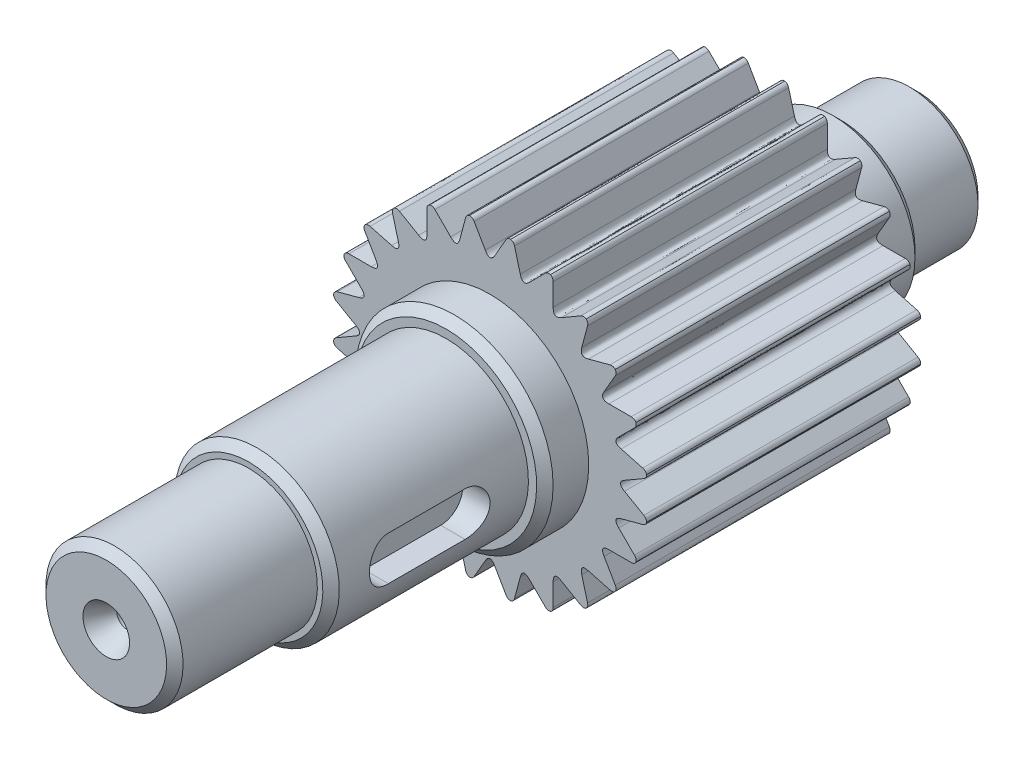
from build123d import *

# Parameters (mm, degrees)
CUT_EXTRUDE_1_DEPTH      = 127.723636311
PATTERN_START            = 28
PATTERN_CIRCULAR_1_DEPTH = 50
CUT_EXTRUDE_START        = 10
CUT_EXTRUDE_2_DEPTH      = 144.407591749
CHAMFER_1_SIZE           = 1.5


with BuildPart() as part:
    # Эскиз1 → Повернуть1 (revolve)
    with BuildSketch(Plane(origin=(0, 0, 0), x_dir=(0, 0, -1), z_dir=(1, 0, 0)), mode=Mode.PRIVATE) as revolve_1_sk:
        Polygon((0, 0), (-148, 0), (-148, -12.5), (-122, -12.5), (-122, -15), (-86, -15), (-86, -18), (-78, -18), (-78, -28.8), (-28, -28.8), (-28, -15), (-14, -15), (-14, -12.5), (0, -12.5), align=None)
    revolve(revolve_1_sk.sketch.rotate(Axis((0, 0, 0), (0, 0, 1)), 180), axis=Axis((0, 0, 0), (0, 0, 1)))

    # Эскиз2 → Вырез-Вытянуть1 (cut, through all)
    with BuildSketch(Plane(origin=(0, 0, 28), x_dir=(-1, 0, 0), z_dir=(0, 0, -1))):
        Polygon((5, 31.686751346), (-5, 31.686751346), (0, 23.026497308), align=None)
    extrude(amount=-CUT_EXTRUDE_1_DEPTH, mode=Mode.SUBTRACT)

    # Круговой массив1: read off the stored shape, not the designer's step
    # Круговой массив1 outline → Круговой массив1 (cut)
    with BuildSketch(Plane.XY.offset(PATTERN_START)):
        with BuildLine():
            Line((26.398581504, -11.513248654), (19.941531629, -11.513248654))
            Line((19.941531629, -11.513248654), (23.170056567, -17.105217879))
            ThreePointArc((23.170056567, -17.105217879), (24.941531629, -14.4), (26.398581504, -11.513248654))
        make_face()
        with BuildLine():
            Line((5.959696045, 22.241888439), (10.525519799, 26.807712191))
            ThreePointArc((10.525519799, 26.807712191), (7.453988499, 27.818663797), (4.288488562, 28.478919675))
            Line((4.288488562, 28.478919675), (5.959696045, 22.241888439))
        make_face()
        with BuildLine():
            Line((11.513248654, 19.941531629), (17.105217879, 23.170056567))
            ThreePointArc((17.105217879, 23.170056567), (14.4, 24.941531629), (11.513248654, 26.398581504))
            Line((11.513248654, 26.398581504), (11.513248654, 19.941531629))
        make_face()
        with BuildLine():
            Line((16.282192394, 16.282192394), (22.51922363, 17.953399876))
            ThreePointArc((22.51922363, 17.953399876), (20.364675298, 20.364675298), (17.953399876, 22.51922363))
            Line((17.953399876, 22.51922363), (16.282192394, 16.282192394))
        make_face()
        with BuildLine():
            Line((19.941531629, 11.513248654), (26.398581504, 11.513248654))
            ThreePointArc((26.398581504, 11.513248654), (24.941531629, 14.4), (23.170056567, 17.105217879))
            Line((23.170056567, 17.105217879), (19.941531629, 11.513248654))
        make_face()
        with BuildLine():
            Line((22.241888439, 5.959696045), (28.478919675, 4.288488562))
            ThreePointArc((28.478919675, 4.288488562), (27.818663797, 7.453988499), (26.807712192, 10.525519799))
            Line((26.807712192, 10.525519799), (22.241888439, 5.959696045))
        make_face()
        with BuildLine():
            Line((23.026497308, 0), (28.618466533, -3.228524938))
            ThreePointArc((28.618466533, -3.228524938), (28.8, 0), (28.618466533, 3.228524938))
            Line((28.618466533, 3.228524938), (23.026497308, 0))
        make_face()
        with BuildLine():
            Line((22.241888439, -5.959696045), (26.807712192, -10.525519799))
            ThreePointArc((26.807712192, -10.525519799), (27.818663797, -7.453988499), (28.478919675, -4.288488562))
            Line((28.478919675, -4.288488562), (22.241888439, -5.959696045))
        make_face()
        with BuildLine():
            ThreePointArc((-4.288488562, 28.478919675), (-7.453988499, 27.818663797), (-10.525519799, 26.807712191))
            Line((-10.525519799, 26.807712191), (-5.959696045, 22.241888439))
            Line((-5.959696045, 22.241888439), (-4.288488562, 28.478919675))
        make_face()
        with BuildLine():
            ThreePointArc((-11.513248654, 26.398581504), (-14.4, 24.941531629), (-17.105217879, 23.170056567))
            Line((-17.105217879, 23.170056567), (-11.513248654, 19.941531629))
            Line((-11.513248654, 19.941531629), (-11.513248654, 26.398581504))
        make_face()
        with BuildLine():
            ThreePointArc((-17.953399876, 22.51922363), (-20.364675298, 20.364675298), (-22.51922363, 17.953399876))
            Line((-22.51922363, 17.953399876), (-16.282192394, 16.282192394))
            Line((-16.282192394, 16.282192394), (-17.953399876, 22.51922363))
        make_face()
        with BuildLine():
            ThreePointArc((-23.170056567, 17.105217879), (-24.941531629, 14.4), (-26.398581504, 11.513248654))
            Line((-26.398581504, 11.513248654), (-19.941531629, 11.513248654))
            Line((-19.941531629, 11.513248654), (-23.170056567, 17.105217879))
        make_face()
        with BuildLine():
            ThreePointArc((-26.807712192, 10.525519799), (-27.818663797, 7.453988499), (-28.478919675, 4.288488562))
            Line((-28.478919675, 4.288488562), (-22.241888439, 5.959696045))
            Line((-22.241888439, 5.959696045), (-26.807712192, 10.525519799))
        make_face()
        with BuildLine():
            ThreePointArc((-28.618466533, 3.228524938), (-28.8, 0), (-28.618466533, -3.228524938))
            Line((-28.618466533, -3.228524938), (-23.026497308, 0))
            Line((-23.026497308, 0), (-28.618466533, 3.228524938))
        make_face()
        with BuildLine():
            ThreePointArc((-28.478919675, -4.288488562), (-27.818663797, -7.453988499), (-26.807712192, -10.525519799))
            Line((-26.807712192, -10.525519799), (-22.241888439, -5.959696045))
            Line((-22.241888439, -5.959696045), (-28.478919675, -4.288488562))
        make_face()
        with BuildLine():
            ThreePointArc((-26.398581504, -11.513248654), (-24.941531629, -14.4), (-23.170056567, -17.105217879))
            Line((-23.170056567, -17.105217879), (-19.941531629, -11.513248654))
            Line((-19.941531629, -11.513248654), (-26.398581504, -11.513248654))
        make_face()
        with BuildLine():
            ThreePointArc((-22.51922363, -17.953399876), (-20.364675298, -20.364675298), (-17.953399876, -22.51922363))
            Line((-17.953399876, -22.51922363), (-16.282192394, -16.282192394))
            Line((-16.282192394, -16.282192394), (-22.51922363, -17.953399876))
        make_face()
        with BuildLine():
            ThreePointArc((-17.105217879, -23.170056567), (-14.4, -24.941531629), (-11.513248654, -26.398581504))
            Line((-11.513248654, -26.398581504), (-11.513248654, -19.941531629))
            Line((-11.513248654, -19.941531629), (-17.105217879, -23.170056567))
        make_face()
        with BuildLine():
            ThreePointArc((-10.525519799, -26.807712192), (-7.453988499, -27.818663797), (-4.288488562, -28.478919675))
            Line((-4.288488562, -28.478919675), (-5.959696045, -22.241888439))
            Line((-5.959696045, -22.241888439), (-10.525519799, -26.807712192))
        make_face()
        with BuildLine():
            ThreePointArc((-3.228524938, -28.618466533), (0, -28.8), (3.228524938, -28.618466533))
            Line((3.228524938, -28.618466533), (0, -23.026497308))
            Line((0, -23.026497308), (-3.228524938, -28.618466533))
        make_face()
        with BuildLine():
            ThreePointArc((4.288488562, -28.478919675), (7.453988499, -27.818663797), (10.525519799, -26.807712192))
            Line((10.525519799, -26.807712192), (5.959696045, -22.241888439))
            Line((5.959696045, -22.241888439), (4.288488562, -28.478919675))
        make_face()
        with BuildLine():
            ThreePointArc((11.513248654, -26.398581504), (14.4, -24.941531629), (17.105217879, -23.170056567))
            Line((17.105217879, -23.170056567), (11.513248654, -19.941531629))
            Line((11.513248654, -19.941531629), (11.513248654, -26.398581504))
        make_face()
        with BuildLine():
            ThreePointArc((17.953399876, -22.51922363), (20.364675298, -20.364675298), (22.51922363, -17.953399876))
            Line((22.51922363, -17.953399876), (16.282192394, -16.282192394))
            Line((16.282192394, -16.282192394), (17.953399876, -22.51922363))
        make_face()
    extrude(amount=PATTERN_CIRCULAR_1_DEPTH, mode=Mode.SUBTRACT)

    # Эскиз4 → Вырез-Повернуть1 (revolve, cut)
    with BuildSketch(Plane(origin=(0, 0, 0), x_dir=(0, 0, -1), z_dir=(1, 0, 0)), mode=Mode.PRIVATE) as cut_revolve_1_sk:
        Polygon((-148, 0), (-137.945299462, 0), (-139.1, 2), (-144.1, 2), (-148, 4.25), align=None)
    cut_revolve_1 = revolve(cut_revolve_1_sk.sketch.rotate(Axis((0, 0, 148), (0, 0, -1)), 90), axis=Axis((0, 0, 148), (0, 0, -1)), mode=Mode.SUBTRACT)

    # Скругление5
    # a fillet whose section is not a circle: 1 mm, written as the material it adds along each edge
    with BuildSketch(Plane(origin=(5.959696045, 22.241888439, 28), x_dir=(0.7071067813414165, 0.7071067810316785, 0), z_dir=(0, 0, 1)), Plane(origin=(16.282192394, 16.282192394, 28), x_dir=(0.9659258263221286, 0.2588190449791379, 0), z_dir=(0, 0, 1)), Plane(origin=(22.241888439, 5.959696045, 28), x_dir=(0.9659258262834112, -0.25881904512363346, 0), z_dir=(0, 0, 1)), Plane(origin=(23.026497308, 0, 28), x_dir=(0.8660254037411079, -0.500000000075051, 0), z_dir=(0, 0, 1)), Plane(origin=(22.241888439, -5.959696045, 28), x_dir=(0.707106781109113, -0.7071067812639822, 0), z_dir=(0, 0, 1)), Plane(origin=(16.282192394, -16.282192394, 28), x_dir=(0.2588190449791379, -0.9659258263221286, 0), z_dir=(0, 0, 1)), Plane(origin=(5.959696045, -22.241888439, 28), x_dir=(-0.25881904512363346, -0.9659258262834112, 0), z_dir=(0, 0, 1)), Plane(origin=(0, -23.026497308, 28), x_dir=(-0.500000000075051, -0.8660254037411079, 0), z_dir=(0, 0, 1)), Plane(origin=(-5.959696045, -22.241888439, 28), x_dir=(-0.7071067812639822, -0.707106781109113, 0), z_dir=(0, 0, 1)), Plane(origin=(-16.282192394, -16.282192394, 28), x_dir=(-0.9659258263221286, -0.2588190449791379, 0), z_dir=(0, 0, 1)), Plane(origin=(-22.241888439, -5.959696045, 28), x_dir=(-0.9659258262834112, 0.25881904512363346, 0), z_dir=(0, 0, 1)), Plane(origin=(-23.026497308, 0, 28), x_dir=(-0.8660254037411079, 0.500000000075051, 0), z_dir=(0, 0, 1)), Plane(origin=(-22.241888439, 5.959696045, 28), x_dir=(-0.707106781109113, 0.7071067812639822, 0), z_dir=(0, 0, 1)), Plane(origin=(-16.282192394, 16.282192394, 28), x_dir=(-0.2588190449791379, 0.9659258263221286, 0), z_dir=(0, 0, 1)), Plane(origin=(-5.959696045, 22.241888439, 28), x_dir=(0.25881904512363313, 0.9659258262834113, 0), z_dir=(0, 0, 1))) as fillet_5_piece_1:
        with BuildLine():
            Bezier((1.732050807, 0), (0, 0), (0.866025403, 1.5), weights=[1, 1, 1])
            Line((0.866025403, 1.5), (0, 0))
            Line((0, 0), (1.732050807, 0))
        make_face()
    extrude(amount=50)
    with BuildSketch(Plane(origin=(11.513248654, 19.941531629, 28), x_dir=(0.8660254037411078, 0.5000000000750511, 0), z_dir=(0, 0, 1)), Plane(origin=(19.941531629, 11.513248654, 28), x_dir=(1, 0, 0), z_dir=(0, 0, 1)), Plane(origin=(19.941531629, -11.513248654, 28), x_dir=(0.5000000000750511, -0.8660254037411078, 0), z_dir=(0, 0, 1)), Plane(origin=(11.513248654, -19.941531629, 28), x_dir=(0, -1, 0), z_dir=(0, 0, 1)), Plane(origin=(-11.513248654, -19.941531629, 28), x_dir=(-0.8660254037411078, -0.5000000000750511, 0), z_dir=(0, 0, 1)), Plane(origin=(-19.941531629, -11.513248654, 28), x_dir=(-1, 0, 0), z_dir=(0, 0, 1)), Plane(origin=(-19.941531629, 11.513248654, 28), x_dir=(-0.5000000000750511, 0.8660254037411078, 0), z_dir=(0, 0, 1)), Plane(origin=(-11.513248654, 19.941531629, 28), x_dir=(0, 1, 0), z_dir=(0, 0, 1)), Plane(origin=(0, 23.026497308, 28), x_dir=(0.5000000000000009, 0.8660254037844382, 0), z_dir=(0, 0, 1))) as fillet_5_piece_2:
        with BuildLine():
            Bezier((1.732050808, 0), (0, 0), (0.866025404, 1.5), weights=[1, 1, 1])
            Line((0.866025404, 1.5), (0, 0))
            Line((0, 0), (1.732050808, 0))
        make_face()
    extrude(amount=50)
    # a fillet whose section is not a circle: 1 mm, written as the material it takes off along each edge
    with BuildSketch(Plane(origin=(-3.228524938, 28.618466533, 79.687470596), x_dir=(-0.9923148556587695, -0.12373854386938385, 0), z_dir=(0, 0, -1)), Plane(origin=(28.478919675, 4.288488562, 26.312529404), x_dir=(0.13730772809693784, -0.9905284386653709, 0), z_dir=(0, 0, 1)), Plane(origin=(4.288488562, -28.478919675, 26.312529404), x_dir=(-0.9905284386653699, -0.1373077280969445, 0), z_dir=(0, 0, 1)), Plane(origin=(-28.478919675, -4.288488562, 26.312529404), x_dir=(-0.13730772809693953, 0.9905284386653708, 0), z_dir=(0, 0, 1)), Plane(origin=(-4.288488562, 28.478919675, 26.312529404), x_dir=(0.9905284386653713, 0.13730772809693437, 0), z_dir=(0, 0, 1))) as fillet_5_2_piece_1:
        with BuildLine():
            Bezier((0.674988238, 0), (0.003323759, 0.007871471), (-0.257969453, -0.61093463), weights=[1, 1, 1])
            Line((-0.257969453, -0.61093463), (0, 0))
            ThreePointArc((0, 0), (0.337494119, 0.001977538), (0.674988238, 0))
        make_face()
    extrude(amount=53.374941192, mode=Mode.SUBTRACT)
    with BuildSketch(Plane(origin=(3.228524938, 28.618466533, 79.687470596), x_dir=(0.9923148556587701, -0.12373854386937931, 0), z_dir=(0, 0, -1))) as fillet_5_2_piece_2:
        with BuildLine():
            Bezier((0.674988238, 0), (0.003323759, -0.007871471), (-0.257969453, 0.61093463), weights=[1, 1, 1])
            Line((-0.257969453, 0.61093463), (0, 0))
            ThreePointArc((0, 0), (0.337494119, -0.001977538), (0.674988238, 0))
        make_face()
    extrude(amount=53.374941192, mode=Mode.SUBTRACT)
    with BuildSketch(Plane(origin=(4.288488562, 28.478919675, 26.312529404), x_dir=(0.2588190451236342, -0.965925826283411, 0), z_dir=(0, 0, 1)), Plane(origin=(11.513248654, 26.398581504, 26.312529404), x_dir=(0, -1, 0), z_dir=(0, 0, 1)), Plane(origin=(17.953399876, 22.51922363, 26.312529404), x_dir=(-0.2588190449791394, -0.9659258263221282, 0), z_dir=(0, 0, 1)), Plane(origin=(23.170056567, 17.105217879, 26.312529404), x_dir=(-0.5000000000750452, -0.8660254037411113, 0), z_dir=(0, 0, 1)), Plane(origin=(28.478919675, -4.288488562, 26.312529404), x_dir=(-0.9659258262834117, -0.2588190451236318, 0), z_dir=(0, 0, 1)), Plane(origin=(26.398581504, -11.513248654, 26.312529404), x_dir=(-1, 0, 0), z_dir=(0, 0, 1)), Plane(origin=(22.51922363, -17.953399876, 26.312529404), x_dir=(-0.9659258263221279, 0.2588190449791408, 0), z_dir=(0, 0, 1)), Plane(origin=(17.105217879, -23.170056567, 26.312529404), x_dir=(-0.8660254037411117, 0.5000000000750445, 0), z_dir=(0, 0, 1)), Plane(origin=(-4.288488562, -28.478919675, 26.312529404), x_dir=(-0.2588190451236318, 0.9659258262834117, 0), z_dir=(0, 0, 1)), Plane(origin=(-11.513248654, -26.398581504, 26.312529404), x_dir=(0, 1, 0), z_dir=(0, 0, 1)), Plane(origin=(-17.953399876, -22.51922363, 26.312529404), x_dir=(0.25881904497913705, 0.9659258263221288, 0), z_dir=(0, 0, 1)), Plane(origin=(-23.170056567, -17.105217879, 26.312529404), x_dir=(0.5000000000750469, 0.8660254037411104, 0), z_dir=(0, 0, 1)), Plane(origin=(-28.478919675, 4.288488562, 26.312529404), x_dir=(0.9659258262834117, 0.2588190451236318, 0), z_dir=(0, 0, 1)), Plane(origin=(-26.398581504, 11.513248654, 26.312529404), x_dir=(1, 0, 0), z_dir=(0, 0, 1)), Plane(origin=(-22.51922363, 17.953399876, 26.312529404), x_dir=(0.9659258263221279, -0.2588190449791407, 0), z_dir=(0, 0, 1)), Plane(origin=(-17.105217879, 23.170056567, 26.312529404), x_dir=(0.8660254037411104, -0.5000000000750469, 0), z_dir=(0, 0, 1))) as fillet_5_2_piece_3:
        with BuildLine():
            Bezier((0.663166164, 0), (-0.008544439, 0), (-0.262568201, -0.621825588), weights=[1, 1, 1])
            ThreePointArc((-0.262568201, -0.621825588), (-0.133105886, -0.310143538), (0, 0))
            Line((0, 0), (0.663166164, 0))
        make_face()
    extrude(amount=53.374941192, mode=Mode.SUBTRACT)
    with BuildSketch(Plane(origin=(10.525519799, 26.807712191, 26.312529403), x_dir=(0.9264766555512484, -0.3763522375628627, 0), z_dir=(0, 0, 1)), Plane(origin=(28.618466533, -3.228524938, 26.312529404), x_dir=(-0.12373854326896404, -0.9923148557336399, 0), z_dir=(0, 0, 1)), Plane(origin=(-3.228524938, -28.618466533, 26.312529404), x_dir=(-0.9923148557336408, 0.1237385432689579, 0), z_dir=(0, 0, 1)), Plane(origin=(-28.618466533, 3.228524938, 26.312529404), x_dir=(0.12373854326896444, 0.9923148557336399, 0), z_dir=(0, 0, 1))) as fillet_5_2_piece_4:
        with BuildLine():
            Bezier((0.674988239, 0), (0.003323759, 0.007871472), (-0.257969453, -0.610934629), weights=[1, 1, 1])
            Line((-0.257969453, -0.610934629), (0, 0))
            ThreePointArc((0, 0), (0.337494119, 0.001977538), (0.674988239, 0))
        make_face()
    extrude(amount=53.374941193, mode=Mode.SUBTRACT)
    with BuildSketch(Plane(origin=(17.105217879, 23.170056567, 26.312529404), x_dir=(0.7975006015373215, -0.6033181503548606, 0), z_dir=(0, 0, 1)), Plane(origin=(22.51922363, 17.953399876, 26.312529404), x_dir=(0.6141761999182358, -0.7891689270707477, 0), z_dir=(0, 0, 1)), Plane(origin=(23.170056567, -17.105217879, 26.312529404), x_dir=(-0.6033181503548574, -0.7975006015373242, 0), z_dir=(0, 0, 1)), Plane(origin=(17.953399876, -22.51922363, 26.312529404), x_dir=(-0.7891689270707438, -0.614176199918241, 0), z_dir=(0, 0, 1)), Plane(origin=(-17.105217879, -23.170056567, 26.312529404), x_dir=(-0.7975006015373254, 0.6033181503548556, 0), z_dir=(0, 0, 1)), Plane(origin=(-22.51922363, -17.953399876, 26.312529404), x_dir=(-0.6141761999182402, 0.7891689270707444, 0), z_dir=(0, 0, 1)), Plane(origin=(-23.170056567, 17.105217879, 26.312529404), x_dir=(0.6033181503548631, 0.7975006015373197, 0), z_dir=(0, 0, 1)), Plane(origin=(-17.953399876, 22.51922363, 26.312529404), x_dir=(0.7891689270707489, 0.6141761999182344, 0), z_dir=(0, 0, 1))) as fillet_5_2_piece_5:
        with BuildLine():
            Bezier((0.674988238, 0), (0.003323758, 0.007871471), (-0.257969453, -0.61093463), weights=[1, 1, 1])
            Line((-0.257969453, -0.61093463), (0, 0))
            ThreePointArc((0, 0), (0.337494119, 0.001977538), (0.674988238, 0))
        make_face()
    extrude(amount=53.374941192, mode=Mode.SUBTRACT)
    with BuildSketch(Plane(origin=(26.398581504, 11.513248654, 26.312529404), x_dir=(0.38899670559598415, -0.9212391454098502, 0), z_dir=(0, 0, 1)), Plane(origin=(11.513248654, -26.398581504, 26.312529404), x_dir=(-0.921239145409845, -0.38899670559599664, 0), z_dir=(0, 0, 1)), Plane(origin=(-26.398581504, -11.513248654, 26.312529404), x_dir=(-0.38899670559599564, 0.9212391454098453, 0), z_dir=(0, 0, 1)), Plane(origin=(-11.513248654, 26.398581504, 26.312529404), x_dir=(0.9212391454098502, 0.38899670559598415, 0), z_dir=(0, 0, 1))) as fillet_5_2_piece_6:
        with BuildLine():
            Bezier((0.674988238, 0), (0.003323759, 0.007871472), (-0.257969453, -0.61093463), weights=[1, 1, 1])
            Line((-0.257969453, -0.61093463), (0, 0))
            ThreePointArc((0, 0), (0.337494119, 0.001977538), (0.674988238, 0))
        make_face()
    extrude(amount=53.374941192, mode=Mode.SUBTRACT)
    with BuildSketch(Plane(origin=(26.807712192, 10.525519799, 26.312529404), x_dir=(-0.7071067811091118, -0.7071067812639832, 0), z_dir=(0, 0, 1)), Plane(origin=(10.525519799, -26.807712192, 26.312529404), x_dir=(-0.7071067812639845, 0.7071067811091105, 0), z_dir=(0, 0, 1)), Plane(origin=(-26.807712192, -10.525519799, 26.312529404), x_dir=(0.707106781109112, 0.7071067812639832, 0), z_dir=(0, 0, 1))) as fillet_5_2_piece_7:
        with BuildLine():
            Bezier((0.663166164, 0), (-0.008544439, 0), (-0.262568201, -0.621825588), weights=[1, 1, 1])
            ThreePointArc((-0.262568201, -0.621825588), (-0.133105886, -0.310143538), (0, 0))
            Line((0, 0), (0.663166164, 0))
        make_face()
    extrude(amount=53.374941191, mode=Mode.SUBTRACT)
    with BuildSketch(Plane(origin=(28.618466533, 3.228524938, 26.312529404), x_dir=(-0.866025403741108, -0.500000000075051, 0), z_dir=(0, 0, 1)), Plane(origin=(3.228524938, -28.618466533, 26.312529404), x_dir=(-0.5000000000750496, 0.8660254037411086, 0), z_dir=(0, 0, 1)), Plane(origin=(-28.618466533, -3.228524938, 26.312529404), x_dir=(0.8660254037411083, 0.5000000000750504, 0), z_dir=(0, 0, 1))) as fillet_5_2_piece_8:
        with BuildLine():
            Bezier((0.663166163, 0), (-0.008544439, 0), (-0.262568201, -0.621825588), weights=[1, 1, 1])
            ThreePointArc((-0.262568201, -0.621825588), (-0.133105886, -0.310143538), (0, 0))
            Line((0, 0), (0.663166163, 0))
        make_face()
    extrude(amount=53.374941193, mode=Mode.SUBTRACT)
    with BuildSketch(Plane(origin=(26.807712192, -10.525519799, 26.312529404), x_dir=(-0.37635223882309643, -0.9264766550393176, 0), z_dir=(0, 0, 1)), Plane(origin=(-10.525519799, -26.807712192, 26.312529404), x_dir=(-0.926476655039318, 0.3763522388230955, 0), z_dir=(0, 0, 1)), Plane(origin=(-26.807712192, 10.525519799, 26.312529404), x_dir=(0.3763522388231055, 0.926476655039314, 0), z_dir=(0, 0, 1))) as fillet_5_2_piece_9:
        with BuildLine():
            Bezier((0.674988238, 0), (0.003323758, 0.007871471), (-0.257969453, -0.61093463), weights=[1, 1, 1])
            Line((-0.257969453, -0.61093463), (0, 0))
            ThreePointArc((0, 0), (0.337494119, 0.001977538), (0.674988238, 0))
        make_face()
    extrude(amount=53.374941191, mode=Mode.SUBTRACT)
    with BuildSketch(Plane(origin=(-10.525519799, 26.807712191, 26.312529403), x_dir=(0.7071067813414175, -0.7071067810316776, 0), z_dir=(0, 0, 1))) as fillet_5_2_piece_10:
        with BuildLine():
            Bezier((0.663166163, 0), (-0.00854444, 0), (-0.262568202, -0.621825588), weights=[1, 1, 1])
            ThreePointArc((-0.262568202, -0.621825588), (-0.133105887, -0.310143538), (0, 0))
            Line((0, 0), (0.663166163, 0))
        make_face()
    extrude(amount=53.374941193, mode=Mode.SUBTRACT)

    # Зеркальное отражение2: Вырез-Повернуть1 across plane
    add(cut_revolve_1.mirror(Plane(origin=(0, 0, 74), x_dir=(1, 0, 0), z_dir=(0, 0, -1))), mode=Mode.SUBTRACT)

    # Эскиз5 → Вырез-Вытянуть2 (cut, through all)
    with BuildSketch(Plane(origin=(0, 0, 0), x_dir=(0, 0, -1), z_dir=(1, 0, 0)).offset(CUT_EXTRUDE_START)):
        with BuildLine():
            Line((-97, -4), (-111, -4))
            ThreePointArc((-111, -4), (-115, 0), (-111, 4))
            Line((-111, 4), (-97, 4))
            ThreePointArc((-97, 4), (-93, 0), (-97, -4))
        make_face()
    extrude(amount=CUT_EXTRUDE_2_DEPTH, mode=Mode.SUBTRACT)

    # Фаска1
    chamfer_1_edges = [part.edges().sort_by_distance(p)[0] for p in [
        (0, -18, 86),
        (0, -15, 14),
        (0, -12.5, 0),
        (0, -12.5, 148),
        (0, -15, 122),
    ]]
    chamfer(chamfer_1_edges, length=CHAMFER_1_SIZE)


solid = part.part
